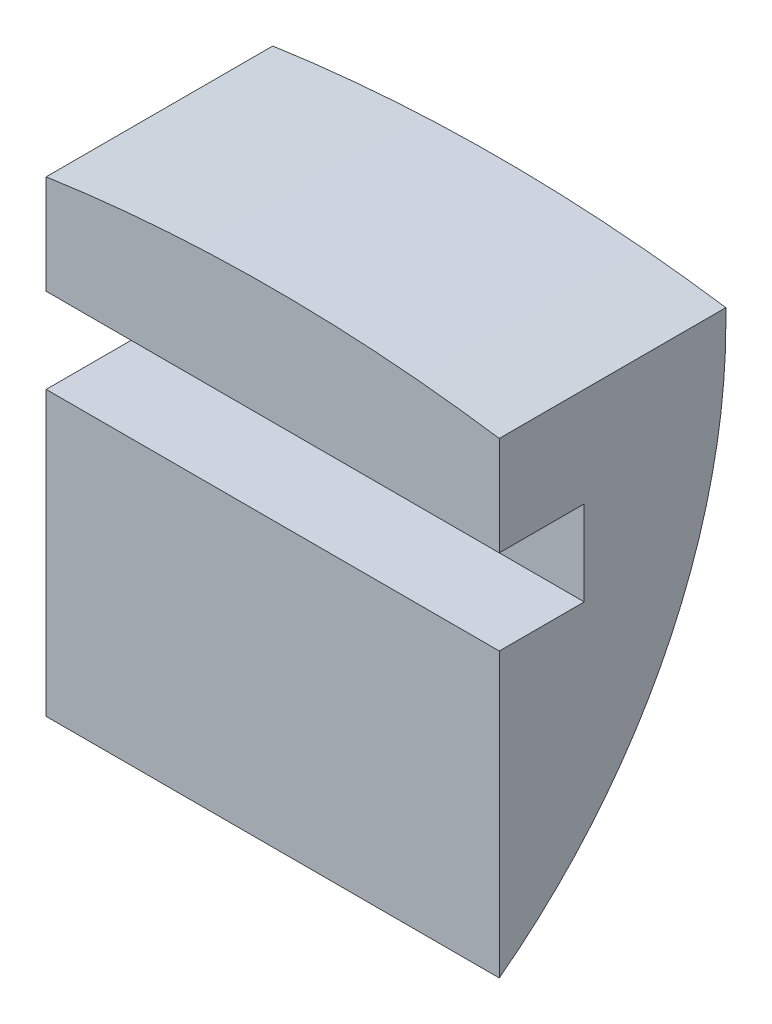
from build123d import *

# Parameters (mm, degrees)
CROQUIS1_W              = 8
CROQUIS1_H              = 5
SALIENTE_EXTRUIR1_DEPTH = 4
CROQUIS2_W              = 8
CROQUIS2_H              = 1.5
CORTAR_EXTRUIR1_DEPTH   = 1.5
CROQUIS3_W              = 8
CROQUIS3_H              = 5
SALIENTE_EXTRUIR2_DEPTH = 4
REDONDEO1_R             = 10


with BuildPart() as part:
    # Croquis1 → Saliente-Extruir1 (new body)
    with BuildSketch(Plane.XY):
        Rectangle(CROQUIS1_W, CROQUIS1_H)
    extrude(amount=SALIENTE_EXTRUIR1_DEPTH)

    # Croquis2 → Cortar-Extruir1 (cut)
    with BuildSketch(Plane.XY.offset(4)):
        Rectangle(CROQUIS2_W, CROQUIS2_H)
    extrude(amount=-CORTAR_EXTRUIR1_DEPTH, mode=Mode.SUBTRACT)

    # Croquis3 → Saliente-Extruir2 (add)
    with BuildSketch(Plane.XY.offset(4)):
        with BuildLine():
            Line((-4, 2.5), (4, 2.5))
            ThreePointArc((4, 2.5), (0, 2.792464279), (-4, 2.5))
        make_face()
        with Locations((0, -3.25)):
            Rectangle(CROQUIS3_W, CROQUIS3_H)
    extrude(amount=-SALIENTE_EXTRUIR2_DEPTH)

    # Redondeo1
    # the kernel refuses this fillet: 10 mm, written as the material it takes off along each edge
    with BuildSketch(Plane(origin=(24, -5.75, 0), x_dir=(0, 0, 1), z_dir=(-1, 0, 0))) as redondeo1_piece_1:
        with BuildLine():
            CenterArc((10, 8), REDONDEO1_R, 180, 53.130102354)
            Line((0, 8), (-0.2, 8))
            Line((-0.2, 8), (-0.2, 0))
            Line((-0.2, 0), (0, -0.2))
            ThreePointArc((0, -0.2), (2, -0.2), (3.88, -0.16))
            Line((3.88, -0.16), (4, 0))
        make_face()
    extrude(amount=48, mode=Mode.SUBTRACT)


solid = part.part
